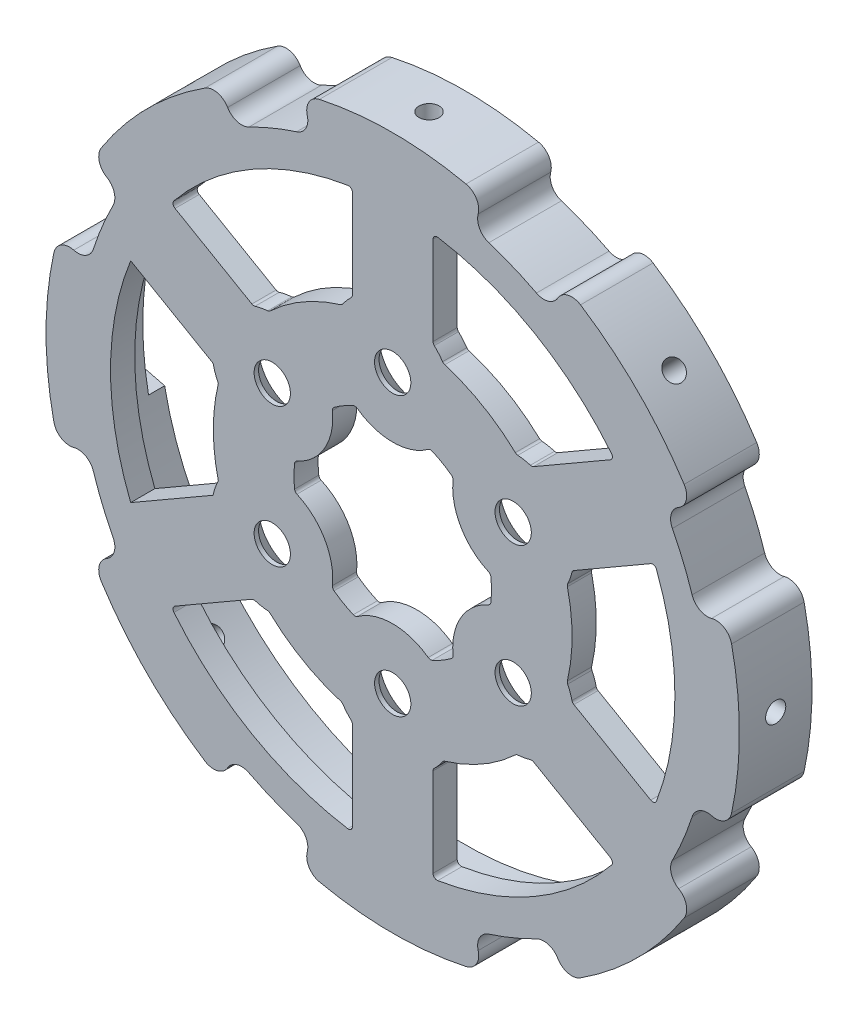
from build123d import *

# Parameters (mm, degrees)
SKETCH_1_R                   = 38
EXTRUDE_1_DEPTH              = 6
EXTRUDE_START                = 3
EXTRUDE_2_DEPTH              = 3
HOLE_WIZARD_M4_1_AT_2_COUNT  = 2
HOLE_WIZARD_M4_1_AT_2_PITCH  = 17.25
HOLE_WIZARD_M4_1_AT_3_COUNT  = 2
HOLE_WIZARD_M4_1_AT_3_PITCH  = 29.877876431
HOLE_WIZARD_M4_1_AT_4_COUNT  = 2
HOLE_WIZARD_M4_1_AT_4_PITCH  = 34.5
HOLE_WIZARD_M4_1_AT_5_COUNT  = 2
HOLE_WIZARD_M4_1_AT_5_PITCH  = 29.877876431
HOLE_WIZARD_M4_1_AT_6_COUNT  = 2
HOLE_WIZARD_M4_1_AT_6_PITCH  = 17.25
HOLE_WIZARD_M3_1_D           = 2.5
HOLE_WIZARD_M3_1_ON_FACE_2_D = 2.5
HOLE_WIZARD_M3_1_ON_FACE_3_D = 2.5
HOLE_WIZARD_M3_1_ON_FACE_4_D = 2.5
HOLE_WIZARD_M3_1_ON_FACE_5_D = 2.5
HOLE_WIZARD_M3_1_ON_FACE_6_D = 2.5
HOLE_WIZARD_M3_1_ON_FACE_7_D = 2.5
HOLE_WIZARD_M3_1_ON_FACE_8_D = 2.5
CUT_EXTRUDE_START            = -3
CUT_EXTRUDE_1_DEPTH          = 3
EXTRUDE_START_2              = -3
EXTRUDE_3_DEPTH              = 1
FILLET_1_R                   = 2
CUT_EXTRUDE_2_DEPTH          = 10
FILLET_6_R                   = 0.5


with BuildPart() as part:
    # 草图1 → 凸台-拉伸1 (new body)
    with BuildSketch(Plane.XY):
        with BuildLine():
            Line((21.5, 37.239092363), (19.5, 33.774990748))
            ThreePointArc((19.5, 33.774990748), (14.924653862, 36.031301768), (10.093942759, 37.671107225))
            Line((10.093942759, 37.671107225), (11.129218939, 41.53481053))
            ThreePointArc((11.129218939, 41.53481053), (5.612626265, 42.632129039), (0, 43))
            ThreePointArc((0, 43), (-5.612626265, 42.632129039), (-11.129218939, 41.53481053))
            Line((-11.129218939, 41.53481053), (-10.093942759, 37.671107225))
            ThreePointArc((-10.093942759, 37.671107225), (-14.924653862, 36.031301768), (-19.5, 33.774990748))
            Line((-19.5, 33.774990748), (-21.5, 37.239092363))
            ThreePointArc((-21.5, 37.239092363), (-26.176741447, 34.114193633), (-30.405591591, 30.405591591))
            ThreePointArc((-30.405591591, 30.405591591), (-34.114193633, 26.176741447), (-37.239092363, 21.5))
            Line((-37.239092363, 21.5), (-33.774990748, 19.5))
            ThreePointArc((-33.774990748, 19.5), (-36.031301768, 14.924653862), (-37.671107225, 10.093942759))
            Line((-37.671107225, 10.093942759), (-41.53481053, 11.129218939))
            ThreePointArc((-41.53481053, 11.129218939), (-42.632129039, 5.612626265), (-43, 0))
            ThreePointArc((-43, 0), (-42.632129039, -5.612626265), (-41.53481053, -11.129218939))
            Line((-41.53481053, -11.129218939), (-37.671107225, -10.093942759))
            ThreePointArc((-37.671107225, -10.093942759), (-36.031301768, -14.924653862), (-33.774990748, -19.5))
            Line((-33.774990748, -19.5), (-37.239092363, -21.5))
            ThreePointArc((-37.239092363, -21.5), (-34.114193633, -26.176741447), (-30.405591591, -30.405591591))
            ThreePointArc((-30.405591591, -30.405591591), (-26.176741447, -34.114193633), (-21.5, -37.239092363))
            Line((-21.5, -37.239092363), (-19.5, -33.774990748))
            ThreePointArc((-19.5, -33.774990748), (-14.924653862, -36.031301768), (-10.093942759, -37.671107225))
            Line((-10.093942759, -37.671107225), (-11.129218939, -41.53481053))
            ThreePointArc((-11.129218939, -41.53481053), (-5.612626265, -42.632129039), (0, -43))
            ThreePointArc((0, -43), (5.612626265, -42.632129039), (11.129218939, -41.53481053))
            Line((11.129218939, -41.53481053), (10.093942759, -37.671107225))
            ThreePointArc((10.093942759, -37.671107225), (14.924653862, -36.031301768), (19.5, -33.774990748))
            Line((19.5, -33.774990748), (21.5, -37.239092363))
            ThreePointArc((21.5, -37.239092363), (26.176741447, -34.114193633), (30.405591591, -30.405591591))
            ThreePointArc((30.405591591, -30.405591591), (34.114193633, -26.176741447), (37.239092363, -21.5))
            Line((37.239092363, -21.5), (33.774990748, -19.5))
            ThreePointArc((33.774990748, -19.5), (36.031301768, -14.924653862), (37.671107225, -10.093942759))
            Line((37.671107225, -10.093942759), (41.53481053, -11.129218939))
            ThreePointArc((41.53481053, -11.129218939), (42.632129039, -5.612626265), (43, 0))
            ThreePointArc((43, 0), (42.632129039, 5.612626265), (41.53481053, 11.129218939))
            Line((41.53481053, 11.129218939), (37.671107225, 10.093942759))
            ThreePointArc((37.671107225, 10.093942759), (36.031301768, 14.924653862), (33.774990748, 19.5))
            Line((33.774990748, 19.5), (37.239092363, 21.5))
            ThreePointArc((37.239092363, 21.5), (34.114193633, 26.176741447), (30.405591591, 30.405591591))
            ThreePointArc((30.405591591, 30.405591591), (26.176741447, 34.114193633), (21.5, 37.239092363))
        make_face()
        Circle(SKETCH_1_R, mode=Mode.SUBTRACT)
    extrude(amount=-EXTRUDE_1_DEPTH)

    # 草图2 → 凸台-拉伸2 (add)
    with BuildSketch(Plane.XY.offset(EXTRUDE_START)):
        with BuildLine():
            Line((-11.129218939, 41.53481053), (-10.093942759, 37.671107225))
            ThreePointArc((-10.093942759, 37.671107225), (-14.924653862, 36.031301768), (-19.5, 33.774990748))
            Line((-19.5, 33.774990748), (-21.5, 37.239092363))
            ThreePointArc((-21.5, 37.239092363), (-26.176741447, 34.114193633), (-30.405591591, 30.405591591))
            ThreePointArc((-30.405591591, 30.405591591), (-34.114193633, 26.176741447), (-37.239092363, 21.5))
            Line((-37.239092363, 21.5), (-33.774990748, 19.5))
            ThreePointArc((-33.774990748, 19.5), (-36.031301768, 14.924653862), (-37.671107225, 10.093942759))
            Line((-37.671107225, 10.093942759), (-41.53481053, 11.129218939))
            ThreePointArc((-41.53481053, 11.129218939), (-42.632129039, 5.612626265), (-43, 0))
            ThreePointArc((-43, 0), (-42.632129039, -5.612626265), (-41.53481053, -11.129218939))
            Line((-41.53481053, -11.129218939), (-37.671107225, -10.093942759))
            ThreePointArc((-37.671107225, -10.093942759), (-36.031301768, -14.924653862), (-33.774990748, -19.5))
            Line((-33.774990748, -19.5), (-37.239092363, -21.5))
            ThreePointArc((-37.239092363, -21.5), (-34.114193633, -26.176741447), (-30.405591591, -30.405591591))
            ThreePointArc((-30.405591591, -30.405591591), (-26.176741447, -34.114193633), (-21.5, -37.239092363))
            Line((-21.5, -37.239092363), (-19.5, -33.774990748))
            ThreePointArc((-19.5, -33.774990748), (-14.924653862, -36.031301768), (-10.093942759, -37.671107225))
            Line((-10.093942759, -37.671107225), (-11.129218939, -41.53481053))
            ThreePointArc((-11.129218939, -41.53481053), (-5.612626265, -42.632129039), (0, -43))
            ThreePointArc((0, -43), (5.612626265, -42.632129039), (11.129218939, -41.53481053))
            Line((11.129218939, -41.53481053), (10.093942759, -37.671107225))
            ThreePointArc((10.093942759, -37.671107225), (14.924653862, -36.031301768), (19.5, -33.774990748))
            Line((19.5, -33.774990748), (21.5, -37.239092363))
            ThreePointArc((21.5, -37.239092363), (26.176741447, -34.114193633), (30.405591591, -30.405591591))
            ThreePointArc((30.405591591, -30.405591591), (34.114193633, -26.176741447), (37.239092363, -21.5))
            Line((37.239092363, -21.5), (33.774990748, -19.5))
            ThreePointArc((33.774990748, -19.5), (36.031301768, -14.924653862), (37.671107225, -10.093942759))
            Line((37.671107225, -10.093942759), (41.53481053, -11.129218939))
            ThreePointArc((41.53481053, -11.129218939), (42.632129039, -5.612626265), (43, 0))
            ThreePointArc((43, 0), (42.632129039, 5.612626265), (41.53481053, 11.129218939))
            Line((41.53481053, 11.129218939), (37.671107225, 10.093942759))
            ThreePointArc((37.671107225, 10.093942759), (36.031301768, 14.924653862), (33.774990748, 19.5))
            Line((33.774990748, 19.5), (37.239092363, 21.5))
            ThreePointArc((37.239092363, 21.5), (34.114193633, 26.176741447), (30.405591591, 30.405591591))
            ThreePointArc((30.405591591, 30.405591591), (26.176741447, 34.114193633), (21.5, 37.239092363))
            Line((21.5, 37.239092363), (19.5, 33.774990748))
            ThreePointArc((19.5, 33.774990748), (14.924653862, 36.031301768), (10.093942759, 37.671107225))
            Line((10.093942759, 37.671107225), (11.129218939, 41.53481053))
            ThreePointArc((11.129218939, 41.53481053), (5.612626265, 42.632129039), (0, 43))
            ThreePointArc((0, 43), (-5.612626265, 42.632129039), (-11.129218939, 41.53481053))
        make_face()
    extrude(amount=-EXTRUDE_2_DEPTH)

    # 草图4 → M4 锥坑平头的锥孔1 (revolve, cut)
    with BuildSketch(Plane(origin=(0, 17.25, 0), x_dir=(0, 1, 0), z_dir=(1, 0, 0))):
        Polygon((0, 0), (0, 3), (2.25, 3), (2.25, 2.45), (4.7, 0), align=None)
    hole_wizard_m4_1 = revolve(axis=Axis((0, 17.25, -6.35), (0, 0, 1)), mode=Mode.SUBTRACT)

    # M4 锥坑平头的锥孔1 at 2: M4 锥坑平头的锥孔1 ×2
    with Locations(*[Vector(0.8660254037844388, -0.49999999999999983, 0) * (i * HOLE_WIZARD_M4_1_AT_2_PITCH) for i in range(1, HOLE_WIZARD_M4_1_AT_2_COUNT)]):
        add(hole_wizard_m4_1, mode=Mode.SUBTRACT)

    # M4 锥坑平头的锥孔1 at 3: M4 锥坑平头的锥孔1 ×2
    with Locations(*[Vector(0.5000000000000001, -0.8660254037844386, 0) * (i * HOLE_WIZARD_M4_1_AT_3_PITCH) for i in range(1, HOLE_WIZARD_M4_1_AT_3_COUNT)]):
        add(hole_wizard_m4_1, mode=Mode.SUBTRACT)

    # M4 锥坑平头的锥孔1 at 4: M4 锥坑平头的锥孔1 ×2
    with Locations(*[(0, -i * HOLE_WIZARD_M4_1_AT_4_PITCH, 0) for i in range(1, HOLE_WIZARD_M4_1_AT_4_COUNT)]):
        add(hole_wizard_m4_1, mode=Mode.SUBTRACT)

    # M4 锥坑平头的锥孔1 at 5: M4 锥坑平头的锥孔1 ×2
    with Locations(*[Vector(-0.4999999999999999, -0.8660254037844387, 0) * (i * HOLE_WIZARD_M4_1_AT_5_PITCH) for i in range(1, HOLE_WIZARD_M4_1_AT_5_COUNT)]):
        add(hole_wizard_m4_1, mode=Mode.SUBTRACT)

    # M4 锥坑平头的锥孔1 at 6: M4 锥坑平头的锥孔1 ×2
    with Locations(*[Vector(-0.8660254037844388, -0.49999999999999983, 0) * (i * HOLE_WIZARD_M4_1_AT_6_PITCH) for i in range(1, HOLE_WIZARD_M4_1_AT_6_COUNT)]):
        add(hole_wizard_m4_1, mode=Mode.SUBTRACT)

    # M3 螺纹孔1 (through all)
    with Locations(Plane(origin=(0, -43, -1.5), x_dir=(-1, 0, 0), z_dir=(0, -1, 0))):
        with Locations((0, 0)):
            Hole(HOLE_WIZARD_M3_1_D / 2)

    # M3 螺纹孔1 on face 2 (through all)
    with Locations(Plane(origin=(30.405591591, -30.405591591, -1.5), x_dir=(-0.707106781187, -0.707106781187, 0), z_dir=(0.707106781187, -0.707106781187, 0))):
        with Locations((0, 0)):
            Hole(HOLE_WIZARD_M3_1_ON_FACE_2_D / 2)

    # M3 螺纹孔1 on face 3 (through all)
    with Locations(Plane(origin=(30.405591592, 30.40559159, -1.5), x_dir=(0.707106781187, -0.707106781187, 0), z_dir=(0.707106781187, 0.707106781187, 0))):
        with Locations((0, 0)):
            Hole(HOLE_WIZARD_M3_1_ON_FACE_3_D / 2)

    # M3 螺纹孔1 on face 4 (through all)
    with Locations(Plane(origin=(43, 0, -1.5), x_dir=(0, 0, 1), z_dir=(1, 0, 0))):
        with Locations((0, 0)):
            Hole(HOLE_WIZARD_M3_1_ON_FACE_4_D / 2)

    # M3 螺纹孔1 on face 5 (through all)
    with Locations(Plane(origin=(-30.405591591, 30.405591591, -1.5), x_dir=(0.707106781187, 0.707106781187, 0), z_dir=(-0.707106781187, 0.707106781187, 0))):
        with Locations((0, 0)):
            Hole(HOLE_WIZARD_M3_1_ON_FACE_5_D / 2)

    # M3 螺纹孔1 on face 6 (through all)
    with Locations(Plane(origin=(-30.40559159, -30.405591592, -1.5), x_dir=(-0.707106781187, 0.707106781187, 0), z_dir=(-0.707106781187, -0.707106781187, 0))):
        with Locations((0, 0)):
            Hole(HOLE_WIZARD_M3_1_ON_FACE_6_D / 2)

    # M3 螺纹孔1 on face 7 (through all)
    with Locations(Plane(origin=(-43, 0, -1.5), x_dir=(0, 0, -1), z_dir=(-1, 0, 0))):
        with Locations((0, 0)):
            Hole(HOLE_WIZARD_M3_1_ON_FACE_7_D / 2)

    # M3 螺纹孔1 on face 8 (through all)
    with Locations(Plane(origin=(0, 43, -1.5), x_dir=(0, 0, 1), z_dir=(0, 1, 0))):
        with Locations((0, 0)):
            Hole(HOLE_WIZARD_M3_1_ON_FACE_8_D / 2)

    # 草图6 → 切除-拉伸1 (cut)
    with BuildSketch(Plane.XY.offset(CUT_EXTRUDE_START)):
        with BuildLine():
            Line((-18.263746174, -1.856603542), (-18.263746174, 1.856603542))
            Line((-18.263746174, 1.856603542), (-21.007623205, 1.856603542))
            Line((-21.007623205, 1.856603542), (-21.007623205, 9.71632359))
            Line((-21.007623205, 9.71632359), (-27.818759506, 9.71632359))
            Line((-27.818759506, 9.71632359), (-30.624630174, 8))
            Line((-30.624630174, 8), (-34.624630174, 8))
            Line((-34.624630174, 8), (-42.579337712, 6))
            ThreePointArc((-42.579337712, 6), (-43, 0), (-42.579337712, -6))
            Line((-42.579337712, -6), (-34.624630174, -8))
            Line((-34.624630174, -8), (-30.624630174, -8))
            Line((-30.624630174, -8), (-29.092197313, -9.71632359))
            Line((-29.092197313, -9.71632359), (-20.563669986, -9.71632359))
            Line((-20.563669986, -9.71632359), (-20.563669986, -1.856603542))
            Line((-20.563669986, -1.856603542), (-18.263746174, -1.856603542))
        make_face()
    extrude(amount=-CUT_EXTRUDE_1_DEPTH, mode=Mode.SUBTRACT)

    # 草图9 → 凸台-拉伸3 (add)
    with BuildSketch(Plane.XY.offset(EXTRUDE_START_2)):
        with BuildLine():
            Line((-42.579337712, 6), (-37.286177193, 7.330824671))
            ThreePointArc((-37.286177193, 7.330824671), (-38, 0), (-37.286177193, -7.330824671))
            Line((-37.286177193, -7.330824671), (-42.579337712, -6))
            ThreePointArc((-42.579337712, -6), (-43, 0), (-42.579337712, 6))
        make_face()
    extrude(amount=-EXTRUDE_3_DEPTH)

    # 圆角1
    fillet_1_edges = [part.edges().sort_by_distance(p)[0] for p in [
        (-21.5, 37.239092363, -1.5),
        (-37.671107225, 10.093942759, -1.5),
        (-37.239092363, 21.5, -1.5),
        (-33.774990748, 19.5, -1.5),
        (-41.53481053, 11.129218939, -1.5),
        (-37.239092363, -21.5, -1.5),
        (-33.774990748, -19.5, -1.5),
        (-37.671107225, -10.093942759, -1.5),
        (-41.53481053, -11.129218939, -1.5),
        (-21.5, -37.239092363, -1.5),
        (-19.5, -33.774990748, -1.5),
        (-11.129218939, -41.53481053, -1.5),
        (-10.093942759, -37.671107225, -1.5),
        (21.5, -37.239092363, -1.5),
        (11.129218939, -41.53481053, -1.5),
        (10.093942759, -37.671107225, -1.5),
        (19.5, -33.774990748, -1.5),
        (37.239092363, -21.5, -1.5),
        (33.774990748, -19.5, -1.5),
        (37.671107225, 10.093942759, -1.5),
        (37.671107225, -10.093942759, -1.5),
        (41.53481053, -11.129218939, -1.5),
        (41.53481053, 11.129218939, -1.5),
        (33.774990748, 19.5, -1.5),
        (37.239092363, 21.5, -1.5),
        (10.093942759, 37.671107225, -1.5),
        (21.5, 37.239092363, -1.5),
        (19.5, 33.774990748, -1.5),
        (11.129218939, 41.53481053, -1.5),
        (-10.093942759, 37.671107225, -1.5),
        (-11.129218939, 41.53481053, -1.5),
        (-19.5, 33.774990748, -1.5),
    ]]
    fillet(fillet_1_edges, radius=FILLET_1_R - 0.0001)  # a hair under: the kernel refuses the full size

    # 草图11 → 切除-拉伸2 (cut)
    with BuildSketch(Plane.XY):
        with BuildLine():
            ThreePointArc((7.512898634, 9.675683651), (6.301687089, 10.504819838), (5, 11.183134623))
            ThreePointArc((5, 11.183134623), (4.812143203, 11.26524646), (4.622938524, 11.344202899))
            ThreePointArc((4.622938524, 11.344202899), (0, 9.75), (-4.622938524, 11.344202899))
            ThreePointArc((-4.622938524, 11.344202899), (-4.812143203, 11.26524646), (-5, 11.183134623))
            ThreePointArc((-5, 11.183134623), (-6.301687089, 10.504819838), (-7.512898634, 9.675683651))
            ThreePointArc((-7.512898634, 9.675683651), (-8.443747687, 4.875), (-12.135837158, 1.668519247))
            ThreePointArc((-12.135837158, 1.668519247), (-12.25, 0), (-12.135837158, -1.668519247))
            ThreePointArc((-12.135837158, -1.668519247), (-8.443747687, -4.875), (-7.512898634, -9.675683651))
            ThreePointArc((-7.512898634, -9.675683651), (-6.125, -10.608811196), (-4.622938524, -11.344202899))
            ThreePointArc((-4.622938524, -11.344202899), (0, -9.75), (4.622938524, -11.344202899))
            ThreePointArc((4.622938524, -11.344202899), (6.125, -10.608811196), (7.512898634, -9.675683651))
            ThreePointArc((7.512898634, -9.675683651), (8.443747687, -4.875), (12.135837158, -1.668519247))
            ThreePointArc((12.135837158, -1.668519247), (12.25, 0), (12.135837158, 1.668519247))
            ThreePointArc((12.135837158, 1.668519247), (8.443747687, 4.875), (7.512898634, 9.675683651))
        make_face()
        with BuildLine():
            ThreePointArc((6.283908229, 21.344202899), (11.125, 19.269065234), (15.342667819, 16.11412561))
            ThreePointArc((15.342667819, 16.11412561), (16.323426556, 15.996105211), (17.280167398, 15.750211991))
            Line((17.280167398, 15.750211991), (27.5, 21.650635095))
            ThreePointArc((27.5, 21.650635095), (17.5, 30.310889132), (5, 34.641016151))
            Line((5, 34.641016151), (5, 22.840169944))
            ThreePointArc((5, 22.840169944), (5.691320196, 22.13455468), (6.283908229, 21.344202899))
        make_face()
        with BuildLine():
            ThreePointArc((22.280167398, 7.089957953), (22.014746753, 6.138449469), (21.626576048, 5.230077288))
            ThreePointArc((21.626576048, 5.230077288), (22.25, 0), (21.626576048, -5.230077288))
            ThreePointArc((21.626576048, -5.230077288), (22.014746753, -6.138449469), (22.280167398, -7.089957953))
            Line((22.280167398, -7.089957953), (32.5, -12.990381057))
            ThreePointArc((32.5, -12.990381057), (35, 0), (32.5, 12.990381057))
            Line((32.5, 12.990381057), (22.280167398, 7.089957953))
        make_face()
        with BuildLine():
            ThreePointArc((-6.283908229, 21.344202899), (-5.691320196, 22.13455468), (-5, 22.840169944))
            Line((-5, 22.840169944), (-5, 34.641016151))
            ThreePointArc((-5, 34.641016151), (-17.5, 30.310889132), (-27.5, 21.650635095))
            Line((-27.5, 21.650635095), (-17.280167398, 15.750211991))
            ThreePointArc((-17.280167398, 15.750211991), (-16.323426556, 15.996105211), (-15.342667819, 16.11412561))
            ThreePointArc((-15.342667819, 16.11412561), (-11.125, 19.269065234), (-6.283908229, 21.344202899))
        make_face()
        with BuildLine():
            ThreePointArc((17.280167398, -15.750211991), (16.323426556, -15.996105211), (15.342667819, -16.11412561))
            ThreePointArc((15.342667819, -16.11412561), (11.125, -19.269065234), (6.283908229, -21.344202899))
            ThreePointArc((6.283908229, -21.344202899), (5.691320196, -22.13455468), (5, -22.840169944))
            Line((5, -22.840169944), (5, -34.641016151))
            ThreePointArc((5, -34.641016151), (17.5, -30.310889132), (27.5, -21.650635095))
            Line((27.5, -21.650635095), (17.280167398, -15.750211991))
        make_face()
        with BuildLine():
            ThreePointArc((-21.626576048, -5.230077288), (-22.25, 0), (-21.626576048, 5.230077288))
            ThreePointArc((-21.626576048, 5.230077288), (-22.014746753, 6.138449469), (-22.280167398, 7.089957953))
            Line((-22.280167398, 7.089957953), (-32.5, 12.990381057))
            ThreePointArc((-32.5, 12.990381057), (-35, 0), (-32.5, -12.990381057))
            Line((-32.5, -12.990381057), (-22.280167398, -7.089957953))
            ThreePointArc((-22.280167398, -7.089957953), (-22.014746753, -6.138449469), (-21.626576048, -5.230077288))
        make_face()
        with BuildLine():
            ThreePointArc((-5, -22.840169944), (-5.691320196, -22.13455468), (-6.283908229, -21.344202899))
            ThreePointArc((-6.283908229, -21.344202899), (-11.125, -19.269065234), (-15.342667819, -16.11412561))
            ThreePointArc((-15.342667819, -16.11412561), (-16.323426556, -15.996105211), (-17.280167398, -15.750211991))
            Line((-17.280167398, -15.750211991), (-27.5, -21.650635095))
            ThreePointArc((-27.5, -21.650635095), (-17.5, -30.310889132), (-5, -34.641016151))
            Line((-5, -34.641016151), (-5, -22.840169944))
        make_face()
    extrude(amount=CUT_EXTRUDE_2_DEPTH, mode=Mode.SUBTRACT)

    # 圆角6
    fillet_6_edges = [part.edges().sort_by_distance(p)[0] for p in [
        (6.283908229, 21.344202899, 1.5),
        (15.342667819, 16.11412561, 1.5),
        (17.280167398, 15.750211991, 1.5),
        (27.5, 21.650635095, 1.5),
        (5, 34.641016151, 1.5),
        (5, 22.840169944, 1.5),
        (21.626576048, 5.230077288, 1.5),
        (21.626576048, -5.230077288, 1.5),
        (22.280167398, -7.089957953, 1.5),
        (32.5, -12.990381057, 1.5),
        (32.5, 12.990381057, 1.5),
        (22.280167398, 7.089957953, 1.5),
        (15.342667819, -16.11412561, 1.5),
        (6.283908229, -21.344202899, 1.5),
        (5, -22.840169944, 1.5),
        (5, -34.641016151, 1.5),
        (27.5, -21.650635095, 1.5),
        (17.280167398, -15.750211991, 1.5),
        (-6.283908229, -21.344202899, 1.5),
        (-15.342667819, -16.11412561, 1.5),
        (-17.280167398, -15.750211991, 1.5),
        (-27.5, -21.650635095, 1.5),
        (-5, -34.641016151, 1.5),
        (-5, -22.840169944, 1.5),
        (7.512898634, 9.675683651, 1.5),
        (4.622938524, 11.344202899, 1.5),
        (-4.622938524, 11.344202899, 1.5),
        (-7.512898634, 9.675683651, 1.5),
        (-12.135837158, 1.668519247, 1.5),
        (-12.135837158, -1.668519247, 1.5),
        (-7.512898634, -9.675683651, 1.5),
        (-4.622938524, -11.344202899, 1.5),
        (4.622938524, -11.344202899, 1.5),
        (7.512898634, -9.675683651, 1.5),
        (12.135837158, -1.668519247, 1.5),
        (12.135837158, 1.668519247, 1.5),
        (-15.342667819, 16.11412561, 1.5),
        (-6.283908229, 21.344202899, 1.5),
        (-5, 22.840169944, 1.5),
        (-5, 34.641016151, 1.5),
        (-27.5, 21.650635095, 1.5),
        (-17.280167398, 15.750211991, 1.5),
    ]]
    fillet(fillet_6_edges, radius=FILLET_6_R)


solid = part.part
